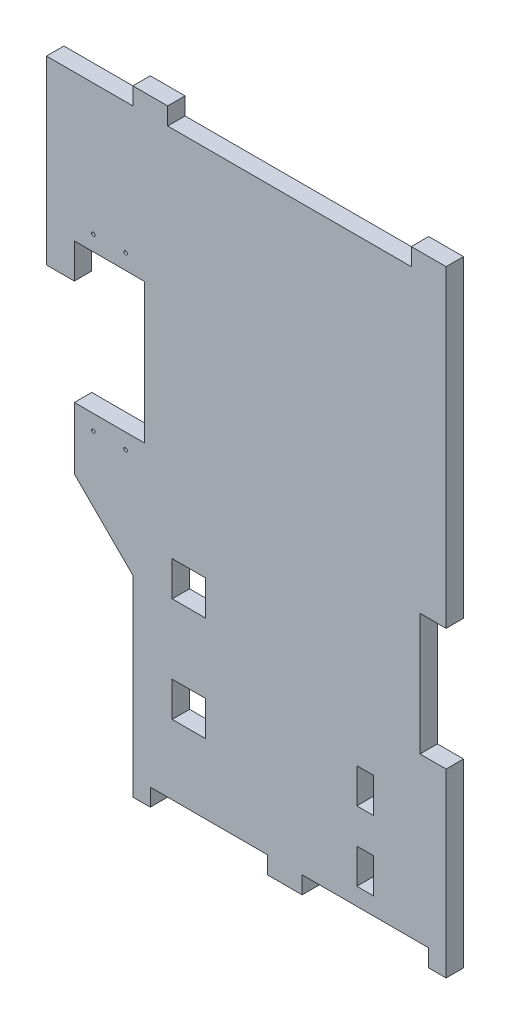
from build123d import *

# Parameters (mm, degrees)
ESQUISSE1_W             = 4.807532778
ESQUISSE1_H             = 10
ESQUISSE1_W_2           = 9.57980661
BOSS_EXTRU_1_DEPTH      = 5
BOSS_EXTRU_2_DEPTH      = 5
ESQUISSE3_W             = 20.2
ESQUISSE3_H             = 40.2
ENL_V_MAT_EXTRU_1_DEPTH = 5
ESQUISSE4_W             = 8
ESQUISSE4_H             = 52
ESQUISSE4_W_2           = 10
ESQUISSE4_H_2           = 5
ESQUISSE4_W_3           = 5
BOSS_EXTRU_3_DEPTH      = 5
ESQUISSE5_R             = 0.5
ENL_V_MAT_EXTRU_2_DEPTH = 5


with BuildPart() as part:
    # Esquisse1 → Boss.-Extru.1 (new body)
    with BuildSketch(Plane.XY):
        Polygon((90, 82), (90, 167), (90, 172), (80, 172), (80, 167), (10, 167), (10, 172), (0, 172), (0, 167), (0, 0), (0, -5), (5, -5), (5, 0), (90, 0), (90, 47), (82.5, 47), (82.5, 82), align=None)
        with Locations((66.738521132, 30)):
            Rectangle(ESQUISSE1_W, ESQUISSE1_H, mode=Mode.SUBTRACT)
        with Locations((66.738521132, 10)):
            Rectangle(ESQUISSE1_W, ESQUISSE1_H, mode=Mode.SUBTRACT)
        with Locations((16.093272864, 25)):
            Rectangle(ESQUISSE1_W_2, ESQUISSE1_H, mode=Mode.SUBTRACT)
        with Locations((16.093272864, 55)):
            Rectangle(ESQUISSE1_W_2, ESQUISSE1_H, mode=Mode.SUBTRACT)
    extrude(amount=BOSS_EXTRU_1_DEPTH)

    # Esquisse2 → Boss.-Extru.2 (add)
    with BuildSketch(Plane.XY.offset(5)):
        Polygon((0, 167), (-16.814476947, 167), (-16.814476947, 67), (0, 50.185523053), align=None)
    extrude(amount=-BOSS_EXTRU_2_DEPTH)

    # Esquisse3 → Enlèv. mat.-Extru.1 (cut)
    with BuildSketch(Plane.XY.offset(5)):
        with Locations((-6.714476947, 104.9)):
            Rectangle(ESQUISSE3_W, ESQUISSE3_H)
    extrude(amount=-ENL_V_MAT_EXTRU_1_DEPTH, mode=Mode.SUBTRACT)

    # Esquisse4 → Boss.-Extru.3 (add)
    with BuildSketch(Plane.XY.offset(5)):
        with Locations((-20.814476947, 141)):
            Rectangle(ESQUISSE4_W, ESQUISSE4_H)
        with Locations((43.633734486, -2.5)):
            Rectangle(ESQUISSE4_W_2, ESQUISSE4_H_2)
        with Locations((87.5, -2.5)):
            Rectangle(ESQUISSE4_W_3, ESQUISSE4_H_2)
    extrude(amount=-BOSS_EXTRU_3_DEPTH)

    # Esquisse5 → Enlèv. mat.-Extru.2 (cut)
    with BuildSketch(Plane.XY.offset(5)):
        with Locations((-11.339476947, 129.4)):
            Circle(ESQUISSE5_R)
        with Locations((-2.089476947, 129.4)):
            Circle(ESQUISSE5_R)
        with Locations((-11.339476947, 80.4)):
            Circle(ESQUISSE5_R)
        with Locations((-2.089476947, 80.4)):
            Circle(ESQUISSE5_R)
    extrude(amount=-ENL_V_MAT_EXTRU_2_DEPTH, mode=Mode.SUBTRACT)


solid = part.part
